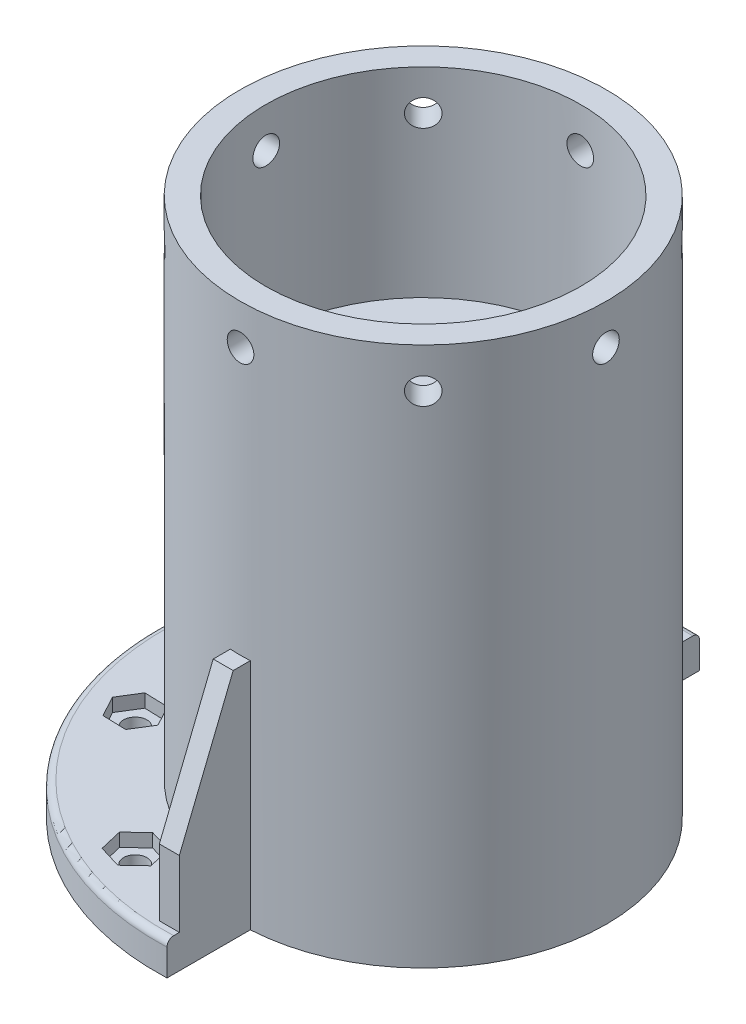
from build123d import *
from OCP.BRepFilletAPI import BRepFilletAPI_MakeChamfer

# Parameters (mm, degrees)
SKETCH1_R           = 27.5
SKETCH1_R_2         = 23.65
BOSS_EXTRUDE1_DEPTH = 30
SKETCH2_R           = 2
CUT_EXTRUDE1_DEPTH  = 50.117206761
CIRPATTERN1_COUNT   = 4
CIRPATTERN1_ANGLE   = 135
BOSS_EXTRUDE2_START = 51
SKETCH3_R           = 27.5
BOSS_EXTRUDE2_DEPTH = 51
BOSS_EXTRUDE3_DEPTH = 5
SKETCH6_W           = 3
SKETCH6_H           = 12
SKETCH6_W_2         = 12
SKETCH6_H_2         = 3
BOSS_EXTRUDE4_DEPTH = 30
CHAMFER1_SIZE       = 20
CHAMFER1_SIZE2      = 8.080524517
SKETCH7_R           = 1.75
CUT_EXTRUDE2_DEPTH  = 95.741754339
CUT_EXTRUDE3_DEPTH  = 2
CIRPATTERN2_COUNT   = 4
CIRPATTERN2_ANGLE   = 135
FILLET1_R           = 1


with BuildPart() as part:
    # Sketch1 → Boss-Extrude1 (new body)
    with BuildSketch(Plane(origin=(0, 0, 0), x_dir=(1, 0, 0), z_dir=(0, 1, 0))):
        Circle(SKETCH1_R)
        Circle(SKETCH1_R_2, mode=Mode.SUBTRACT)
    extrude(amount=BOSS_EXTRUDE1_DEPTH)

    # Sketch2 → Cut-Extrude1 (cut, symmetric)
    with BuildSketch(Plane.XY):
        with Locations((0, 24)):
            Circle(SKETCH2_R)
    cut_extrude1 = extrude(amount=CUT_EXTRUDE1_DEPTH, both=True, mode=Mode.SUBTRACT)

    # CirPattern1: Cut-Extrude1 ×4 about axis
    cirpattern1_axis = Axis((0, 30, 0), (0, 1, 0))
    for i in range(1, CIRPATTERN1_COUNT):
        add(cut_extrude1.rotate(cirpattern1_axis, i * CIRPATTERN1_ANGLE / (CIRPATTERN1_COUNT - 1)), mode=Mode.SUBTRACT)

    # Sketch3 → Boss-Extrude2 (add)
    with BuildSketch(Plane.XZ.offset(BOSS_EXTRUDE2_START)):
        Circle(SKETCH3_R)
    extrude(amount=-BOSS_EXTRUDE2_DEPTH)

    # Sketch4 → Boss-Extrude3 (add)
    with BuildSketch(Plane.XZ.offset(51)):
        with BuildLine():
            ThreePointArc((1.5, 39.971865105), (-40, 0), (1.5, -39.971865105))
            Line((1.5, -39.971865105), (1.5, 39.971865105))
        make_face()
    extrude(amount=-BOSS_EXTRUDE3_DEPTH)

    # Sketch6 → Boss-Extrude4 (add)
    with BuildSketch(Plane(origin=(0, -46, 0), x_dir=(1, 0, 0), z_dir=(0, 1, 0))):
        with Locations((0, 30.644528231)):
            Rectangle(SKETCH6_W, SKETCH6_H)
        with Locations((-30.709825096, -0.28052704)):
            Rectangle(SKETCH6_W_2, SKETCH6_H_2)
        with Locations((0, -32.114539573)):
            Rectangle(SKETCH6_W, SKETCH6_H)
    extrude(amount=BOSS_EXTRUDE4_DEPTH)

    # Chamfer1: one chamfer whose edges measure the first distance from different faces: ONE call of the kernel's chamfer builder (chamfer() names one face for all edges)
    chamfer1_edges_1 = [part.edges().sort_by_distance(p)[0] for p in [
        (0, -16, -36.644528231),
    ]]
    chamfer1_side_1 = [part.faces().sort_by_distance(p)[0] for p in [
        (0, -31, -36.644528231),
    ]]
    chamfer1_edges_2 = [part.edges().sort_by_distance(p)[0] for p in [
        (-36.709825096, -16, 0.28052704),
    ]]
    chamfer1_side_2 = [part.faces().sort_by_distance(p)[0] for p in [
        (-36.709825096, -31, 0.28052704),
    ]]
    chamfer1_edges_3 = [part.edges().sort_by_distance(p)[0] for p in [
        (0, -16, 38.114539573),
    ]]
    chamfer1_side_3 = [part.faces().sort_by_distance(p)[0] for p in [
        (0, -31, 38.114539573),
    ]]
    chamfer1 = BRepFilletAPI_MakeChamfer(part.part.solid().wrapped)
    for e in chamfer1_edges_1:
        chamfer1.Add(CHAMFER1_SIZE, CHAMFER1_SIZE2, e.wrapped, chamfer1_side_1[0].wrapped)  # the first distance lies on this face
    for e in chamfer1_edges_2:
        chamfer1.Add(CHAMFER1_SIZE, CHAMFER1_SIZE2, e.wrapped, chamfer1_side_2[0].wrapped)  # the first distance lies on this face
    for e in chamfer1_edges_3:
        chamfer1.Add(CHAMFER1_SIZE, CHAMFER1_SIZE2, e.wrapped, chamfer1_side_3[0].wrapped)  # the first distance lies on this face
    add(Compound.cast(chamfer1.Shape()), mode=Mode.REPLACE)

    # Sketch7 → Cut-Extrude2 (cut, through all)
    with BuildSketch(Plane(origin=(0, -46, 0), x_dir=(1, 0, 0), z_dir=(0, 1, 0))):
        with Locations((-12.663510369, 30.572418481)):
            Circle(SKETCH7_R)
    cut_extrude2 = extrude(amount=-CUT_EXTRUDE2_DEPTH, mode=Mode.SUBTRACT)

    # Sketch8 → Cut-Extrude3 (cut)
    with BuildSketch(Plane(origin=(0, -46, 0), x_dir=(1, 0, 0), z_dir=(0, 1, 0))):
        Polygon((-9.561603451, 32.24020348), (-12.556901088, 34.092641172), (-15.658808006, 32.424856172), (-15.765417287, 28.904633481), (-12.770119651, 27.05219579), (-9.668212733, 28.719980789), align=None)
    cut_extrude3 = extrude(amount=-CUT_EXTRUDE3_DEPTH, mode=Mode.SUBTRACT)

    # CirPattern2: Cut-Extrude2, Cut-Extrude3 ×4 about axis
    cirpattern2_axis = Axis((0, -46, 0), (0, 1, 0))
    add([cut_extrude2.rotate(cirpattern2_axis, i * CIRPATTERN2_ANGLE / (CIRPATTERN2_COUNT - 1)) for i in range(1, CIRPATTERN2_COUNT)], mode=Mode.SUBTRACT)
    add([cut_extrude3.rotate(cirpattern2_axis, i * CIRPATTERN2_ANGLE / (CIRPATTERN2_COUNT - 1)) for i in range(1, CIRPATTERN2_COUNT)], mode=Mode.SUBTRACT)

    # Fillet1
    fillet1_edges = [part.edges().sort_by_distance(p)[0] for p in [
        (-40, -46, 0),
    ]]
    fillet(fillet1_edges, radius=FILLET1_R)


solid = part.part
